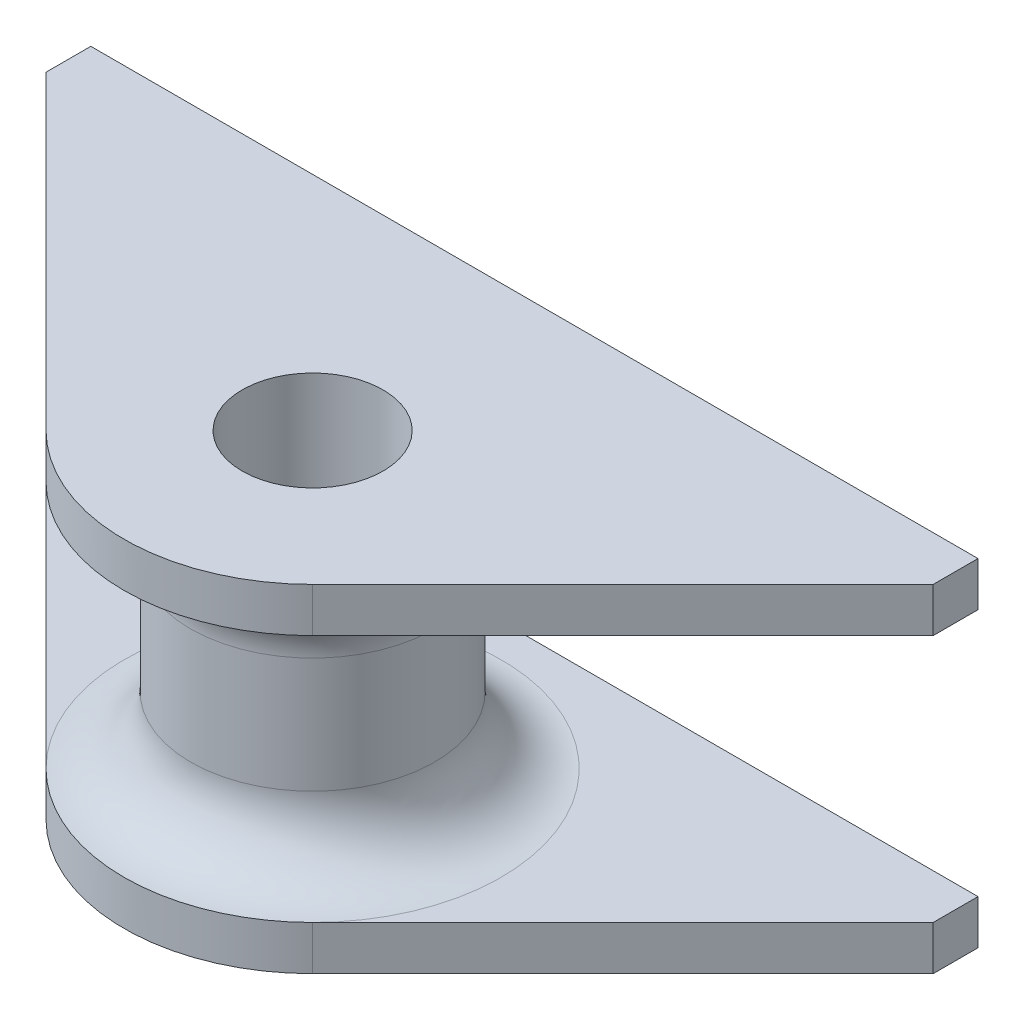
from build123d import *

# Parameters (mm, degrees)
BOSS_EXTRUDE1_DEPTH      = 7.6
BOSS_EXTRUDE1_DEPTH_BACK = 7.6
SKETCH1_R                = 5.5
SKETCH1_R_2              = 3.175
BOSS_EXTRUDE2_START      = 7.6
SKETCH2_R                = 5.5
BOSS_EXTRUDE2_DEPTH      = 2
BOSS_EXTRUDE3_START      = -5.6
SKETCH2_2_R              = 5.5
BOSS_EXTRUDE3_DEPTH      = 2


with BuildPart() as part:
    # Sketch1 → Boss-Extrude1 (new, two sides: drawn at the far end of the back side and taken through both)
    with BuildSketch(Plane(origin=(0, 0, 0), x_dir=(1, 0, 0), z_dir=(0, 1, 0)).offset(-BOSS_EXTRUDE1_DEPTH_BACK)):
        with Locations(Location((0, 0, 0), (0, 0, 270))):
            Circle(SKETCH1_R)
        with Locations(Location((0, 0, 0), (0, 0, 270))):
            Circle(SKETCH1_R_2, mode=Mode.SUBTRACT)
    extrude(amount=BOSS_EXTRUDE1_DEPTH + BOSS_EXTRUDE1_DEPTH_BACK)

    # Sketch2 → Boss-Extrude2 (add)
    with BuildSketch(Plane(origin=(0, 0, 0), x_dir=(1, 0, 0), z_dir=(0, 1, 0)).offset(BOSS_EXTRUDE2_START)):
        with BuildLine():
            Line((-20, 10), (20, 10))
            Line((20, 10), (20, 7.97918472))
            Line((20, 7.97918472), (6.01040764, -6.01040764))
            ThreePointArc((6.01040764, -6.01040764), (0, -8.5), (-6.01040764, -6.01040764))
            Line((-6.01040764, -6.01040764), (-20, 7.97918472))
            Line((-20, 7.97918472), (-20, 10))
        make_face()
        with Locations(Location((0, 0, 0), (0, 0, 270))):
            Circle(SKETCH2_R, mode=Mode.SUBTRACT)
    extrude(amount=-BOSS_EXTRUDE2_DEPTH)

    # Sketch2<2> → Boss-Extrude3 (add)
    with BuildSketch(Plane(origin=(0, 0, 0), x_dir=(1, 0, 0), z_dir=(0, 1, 0)).offset(BOSS_EXTRUDE3_START)):
        with BuildLine():
            Line((-20, 10), (20, 10))
            Line((20, 10), (20, 7.97918472))
            Line((20, 7.97918472), (6.01040764, -6.01040764))
            ThreePointArc((6.01040764, -6.01040764), (0, -8.5), (-6.01040764, -6.01040764))
            Line((-6.01040764, -6.01040764), (-20, 7.97918472))
            Line((-20, 7.97918472), (-20, 10))
        make_face()
        with Locations(Location((0, 0, 0), (0, 0, 270))):
            Circle(SKETCH2_2_R, mode=Mode.SUBTRACT)
    extrude(amount=-BOSS_EXTRUDE3_DEPTH)

    # Fillet1: read off the stored shape, not the designer's step
    # Fillet1 outline → Fillet1 (revolve)
    with BuildSketch(Plane.XY):
        with BuildLine():
            ThreePointArc((5.5, 2.6), (6.378679656, 4.721320344), (8.5, 5.6))
            Line((8.5, 5.6), (5.5, 5.6))
            Line((5.5, 5.6), (5.5, 2.6))
        make_face()
        with BuildLine():
            ThreePointArc((8.5, -5.6), (6.378679656, -4.721320344), (5.5, -2.6))
            Line((5.5, -2.6), (5.5, -5.6))
            Line((5.5, -5.6), (8.5, -5.6))
        make_face()
    revolve(axis=Axis((0, 0, 0), (0, 1, 0)))


solid = part.part
